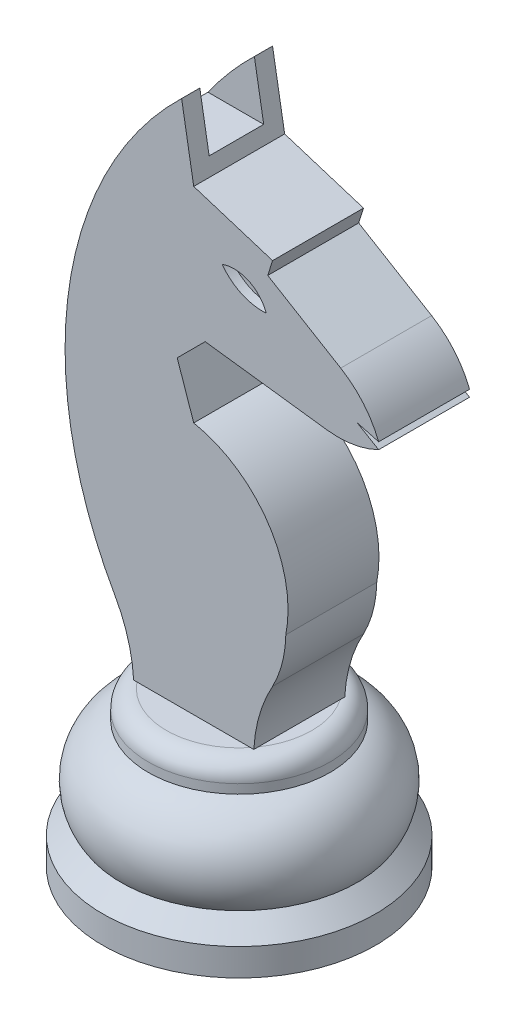
from build123d import *

# Parameters (mm, degrees)
SKETCH2_W               = 15
SKETCH2_H               = 3
BOSS_EXTRUDE1_DEPTH     = 5
SKETCH4_W               = 6
SKETCH4_H               = 7.676307803
CUT_EXTRUDE1_DEPTH      = 10
FILLET2_R               = 10
FILLET3_R               = 10
CUT_EXTRUDE2_DEPTH      = 80.142875261
CUT_EXTRUDE2_DEPTH_BACK = 80.142875261
BOSS_EXTRUDE2_DEPTH     = 4


with BuildPart() as part:
    # Sketch2 → Revolve1 (revolve)
    with BuildSketch(Plane.XY, mode=Mode.PRIVATE) as revolve1_sk:
        with BuildLine():
            ThreePointArc((-10, 14.97), (-9.414213562, 16.384213562), (-8, 16.97))
            Line((-8, 16.97), (0, 16.97))
            Line((0, 16.97), (0, 14.97))
            Line((0, 14.97), (0, 13.97))
            Line((0, 13.97), (0, 5))
            Line((0, 5), (0, 3))
            Line((0, 3), (-15, 3))
            Line((-15, 3), (-13, 5))
            ThreePointArc((-13, 5), (-13.688325627, 10.216881481), (-10, 13.97))
            Line((-10, 13.97), (-10, 14.97))
        make_face()
        with Locations((-7.5, 1.5)):
            Rectangle(SKETCH2_W, SKETCH2_H)
    revolve(revolve1_sk.sketch.rotate(Axis((0, 5, 0), (0, 1, 0)), 270), axis=Axis((0, 5, 0), (0, 1, 0)))

    # Sketch3 → Boss-Extrude1 (add, symmetric)
    with BuildSketch(Plane.XY):
        with BuildLine():
            ThreePointArc((0, 44.765662821), (8.195556272, 39.305823104), (10.13, 29.65))
            ThreePointArc((10.13, 29.65), (9.728307106, 26.745012699), (8.67, 24.01))
            ThreePointArc((8.67, 24.01), (7.233209761, 20.609032371), (6.61, 16.97))
            Line((6.61, 16.97), (-6.61, 16.97))
            ThreePointArc((-6.61, 16.97), (-7.233209761, 20.609032371), (-8.67, 24.01))
            ThreePointArc((-8.67, 24.01), (-13.717238878, 50.759844741), (-1.33, 75))
            Line((-1.33, 75), (0, 67.29))
            Line((0, 67.29), (8.67, 64.56))
            Line((8.67, 64.56), (8.14100346, 62.88))
            Line((8.14100346, 62.88), (20.337027919, 55.57))
            Line((20.337027919, 55.57), (20.337027919, 53.136090211))
            Line((20.337027919, 53.136090211), (17.983362656, 53.773319693))
            Line((17.983362656, 53.773319693), (20.337027919, 52.381882691))
            Line((20.337027919, 52.381882691), (20.337027919, 50.702180422))
            Line((20.337027919, 50.702180422), (1.260409295, 53.136090211))
            Line((1.260409295, 53.136090211), (-1.816215968, 50.059464948))
            Line((-1.816215968, 50.059464948), (0, 44.765662821))
        make_face()
    extrude(amount=BOSS_EXTRUDE1_DEPTH, both=True)

    # Sketch4 → Cut-Extrude1 (cut)
    with BuildSketch(Plane(origin=(0, 0, 0), x_dir=(0, 0, -1), z_dir=(1, 0, 0))):
        with Locations((0, 72.886493521)):
            Rectangle(SKETCH4_W, SKETCH4_H)
    extrude(amount=-CUT_EXTRUDE1_DEPTH, mode=Mode.SUBTRACT)

    # Fillet2
    # the kernel refuses this fillet: 10 mm, written as the material it takes off along each edge
    with BuildSketch(Plane(origin=(20.337027919, 55.57, 17.159563067), x_dir=(-0.8577290982340794, 0.5141019296234484, 0), z_dir=(0, 0, -1))) as fillet2_piece_1:
        with BuildLine():
            CenterArc((4.863825227, -10), FILLET2_R, 90, 37.698787392)
            Line((-1.251277719, -2.087635248), (-1.373579778, -1.929387953))
            ThreePointArc((-1.373579778, -1.929387953), (-0.797184679, -0.940997238), (-0.17154582, 0.102820386))
            Line((-0.17154582, 0.102820386), (0, 0.2))
            Line((0, 0.2), (4.863825227, 0.2))
            Line((4.863825227, 0.2), (4.863825227, 0))
        make_face()
    extrude(amount=34.319126134, mode=Mode.SUBTRACT)

    # Fillet3
    # the kernel refuses this fillet: 10 mm, written as the material it takes off along each edge
    with BuildSketch(Plane(origin=(20.337027919, 50.702180422, 19.348952899), x_dir=(-0.9919589424380495, 0.12656009053878878, 0), z_dir=(0, 0, -1))) as fillet3_piece_1:
        with BuildLine():
            CenterArc((5.73958116, 10), FILLET3_R, 236.447572357, 33.552427643)
            Line((0.212583271, 1.666195686), (0.102043313, 1.4995196))
            ThreePointArc((0.102043313, 1.4995196), (-0.092100153, 0.858409861), (-0.198391788, 0.025312018))
            Line((-0.198391788, 0.025312018), (0, -0.2))
            Line((0, -0.2), (5.73958116, -0.2))
            Line((5.73958116, -0.2), (5.73958116, 0))
        make_face()
    extrude(amount=38.697905798, mode=Mode.SUBTRACT)

    # Sketch5 → Cut-Extrude2 (cut, two sides: drawn at the far end of the back side and taken through both)
    with BuildSketch(Plane.XY.offset(-CUT_EXTRUDE2_DEPTH_BACK)):
        with BuildLine():
            ThreePointArc((3.123689943, 61.436717182), (5.265012371, 59.692471778), (7.983104726, 59.202953935))
            ThreePointArc((7.983104726, 59.202953935), (6.01602485, 61.326253313), (3.123689943, 61.436717182))
        make_face()
    extrude(amount=CUT_EXTRUDE2_DEPTH + CUT_EXTRUDE2_DEPTH_BACK, mode=Mode.SUBTRACT)

    # Sketch5<3> → Boss-Extrude2 (add, symmetric)
    with BuildSketch(Plane.XY):
        with BuildLine():
            ThreePointArc((3.123689943, 61.436717182), (5.265012371, 59.692471778), (7.983104726, 59.202953935))
            ThreePointArc((7.983104726, 59.202953935), (6.01602485, 61.326253313), (3.123689943, 61.436717182))
        make_face()
    extrude(amount=BOSS_EXTRUDE2_DEPTH, both=True)


solid = part.part
